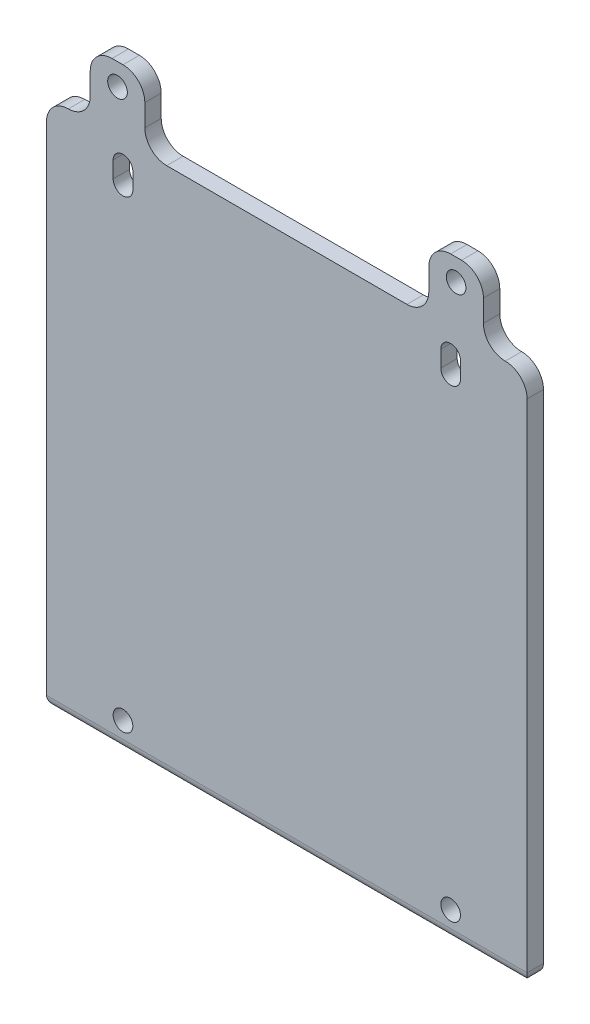
from build123d import *

# Parameters (mm, degrees)
SKETCH1_R           = 1.8
BOSS_EXTRUDE1_DEPTH = 3
FILLET1_R           = 4
FILLET2_R           = 2


with BuildPart() as part:
    # Sketch1 → Boss-Extrude1 (new body)
    with BuildSketch(Plane.XY):
        Polygon((-88, 0), (0, 0), (0, 97), (-8, 97), (-8, 109), (-18, 109), (-18, 97), (-70, 97), (-70, 109), (-80, 109), (-80, 97), (-88, 97), align=None)
        with Locations((-74, 5)):
            Circle(SKETCH1_R, mode=Mode.SUBTRACT)
        with Locations((-14, 5)):
            Circle(SKETCH1_R, mode=Mode.SUBTRACT)
        with BuildLine():
            ThreePointArc((-75.8, 93), (-74, 94.8), (-72.2, 93))
            Line((-72.2, 93), (-72.2, 90))
            ThreePointArc((-72.2, 90), (-74, 88.2), (-75.8, 90))
            Line((-75.8, 90), (-75.8, 93))
        make_face(mode=Mode.SUBTRACT)
        with BuildLine():
            ThreePointArc((-12.2, 90), (-14, 88.2), (-15.8, 90))
            Line((-15.8, 90), (-15.8, 93))
            ThreePointArc((-15.8, 93), (-14, 94.8), (-12.2, 93))
            Line((-12.2, 93), (-12.2, 90))
        make_face(mode=Mode.SUBTRACT)
        with Locations((-13, 105)):
            Circle(SKETCH1_R, mode=Mode.SUBTRACT)
        with Locations((-75, 105)):
            Circle(SKETCH1_R, mode=Mode.SUBTRACT)
    extrude(amount=BOSS_EXTRUDE1_DEPTH)

    # Fillet1
    fillet1_edges = [part.edges().sort_by_distance(p)[0] for p in [
        (-70, 109, 1.5),
        (-70, 97, 1.5),
        (-18, 97, 1.5),
        (-18, 109, 1.5),
        (-8, 109, 1.5),
        (-8, 97, 1.5),
        (0, 97, 1.5),
        (-88, 97, 1.5),
        (-80, 97, 1.5),
        (-80, 109, 1.5),
    ]]
    fillet(fillet1_edges, radius=FILLET1_R - 0.0001)  # a hair under: the kernel refuses the full size

    # Fillet2
    fillet2_edges = [part.edges().sort_by_distance(p)[0] for p in [
        (-44, 0, 3),
        (0, 0, 1.5),
        (-88, 0, 1.5),
    ]]
    fillet(fillet2_edges, radius=FILLET2_R)


solid = part.part
